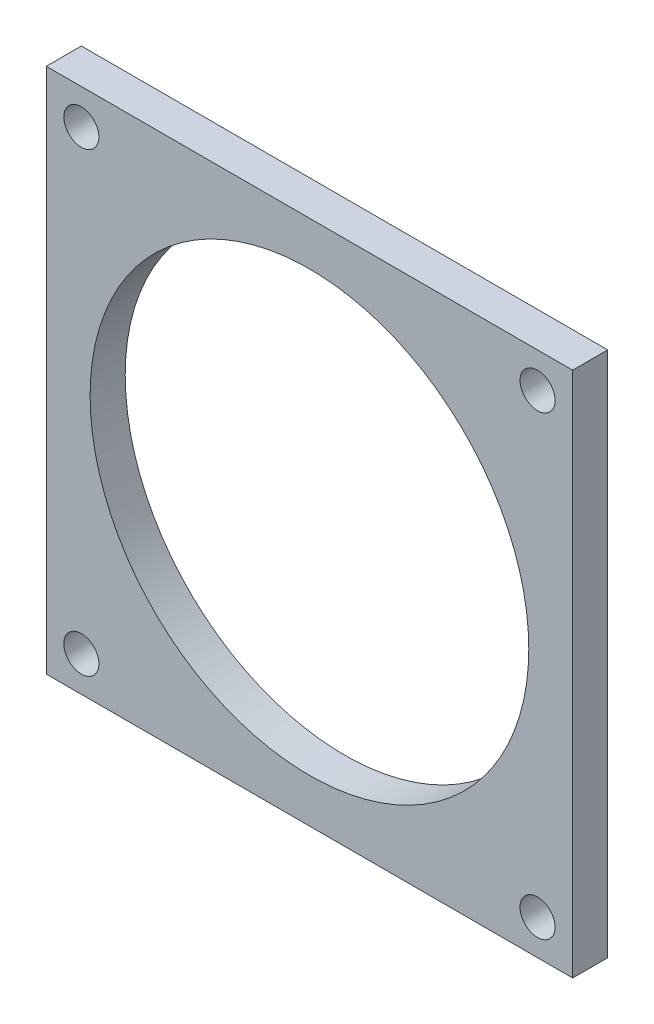
from build123d import *

# Parameters (mm, degrees)
SKETCH1_W               = 38.1
SKETCH1_H               = 38.1
BOSS_EXTRUDE1_DEPTH     = 2.54
CUT_EXTRUDE1_DEPTH      = 28.060240206
CUT_EXTRUDE1_DEPTH_BACK = 28.060240206
SKETCH2_R               = 15.875
HOLE1_OUTLINE_R         = 1.27
HOLE1_DEPTH             = 2.54


# Read off the part's stored shape, not the designer's step: Hole1
with BuildPart() as part:
    # Sketch1 → Boss-Extrude1 (new body)
    with BuildSketch(Plane.XY):
        Rectangle(SKETCH1_W, SKETCH1_H)
    extrude(amount=BOSS_EXTRUDE1_DEPTH)

    # Sketch2 → Cut-Extrude1 (cut, two sides: drawn at the far end of the back side and taken through both)
    with BuildSketch(Plane.XY.offset(2.54).offset(-CUT_EXTRUDE1_DEPTH_BACK)):
        Circle(SKETCH2_R)
    extrude(amount=CUT_EXTRUDE1_DEPTH + CUT_EXTRUDE1_DEPTH_BACK, mode=Mode.SUBTRACT)

    # Hole1 outline → Hole1 (cut)
    with BuildSketch(Plane.XY):
        with Locations((-16.51, 16.51)):
            Circle(HOLE1_OUTLINE_R)
        with Locations((16.51, 16.51)):
            Circle(HOLE1_OUTLINE_R)
        with Locations((16.51, -16.51)):
            Circle(HOLE1_OUTLINE_R)
        with Locations((-16.51, -16.51)):
            Circle(HOLE1_OUTLINE_R)
    extrude(amount=HOLE1_DEPTH, mode=Mode.SUBTRACT)


solid = part.part
